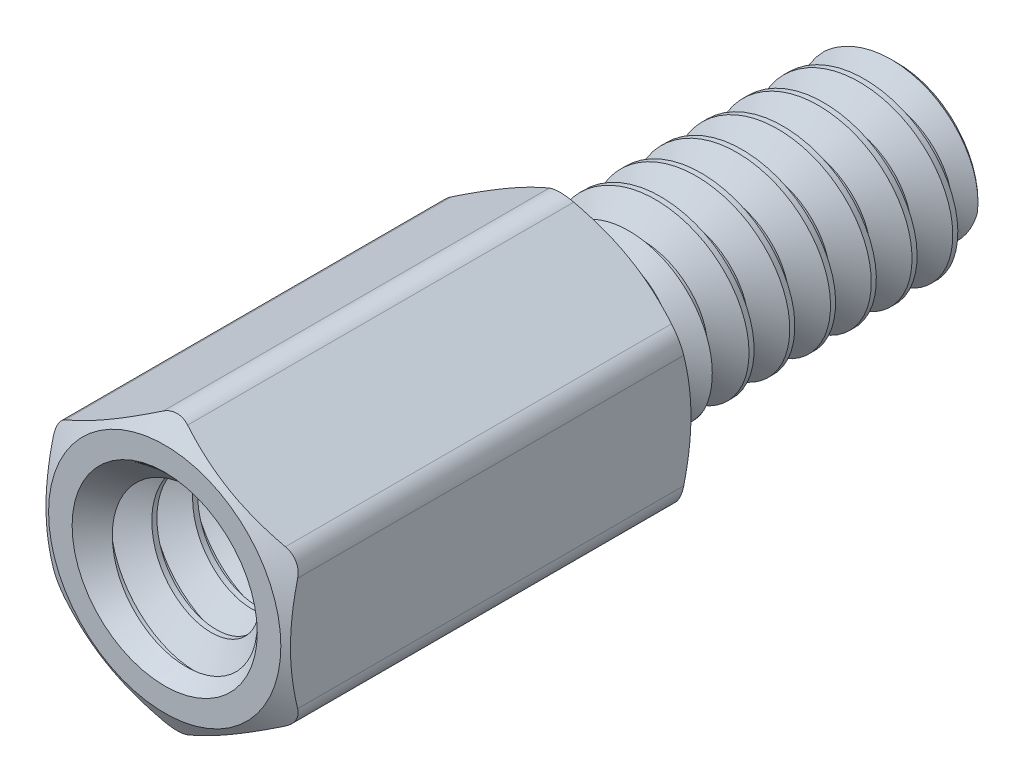
from build123d import *

# Parameters (mm, degrees)
SKETCH4_R              = 2.066925
BOSS_EXTRUDE1_DEPTH    = 7.9375
SKETCH5_OUTSIDE_W      = 64.504
SKETCH5_OUTSIDE_H      = 65.242
SKETCH5_OUTSIDE_R      = 2.2621875
CUT_EXTRUDE1_DEPTH     = 15.743251899
CUT_EXTRUDE1_DRAFT     = -60
SKETCH6_OUTSIDE_W      = 43.678
SKETCH6_OUTSIDE_H      = 44.416
SKETCH6_OUTSIDE_R      = 2.2621875
CUT_EXTRUDE2_DEPTH     = 9.73125
CUT_EXTRUDE2_DRAFT     = -60
FILLET1_R              = 0.47625
CUT_SWEEP1_PITCH       = 0.79375
CUT_SWEEP1_HEIGHT      = 6.1595
CUT_SWEEP1_RADIUS      = 1.7526
CUT_SWEEP1_START_ANGLE = 90
SKETCH9_R              = 1.9510375
BOSS_EXTRUDE2_DEPTH    = 5.5626
SKETCH10_W             = 5.5626
SKETCH10_H             = 1.7526
CUT_SWEEP2_PITCH       = 0.79375


with BuildPart() as part:
    # Sketch3 → Revolve1 (revolve)
    with BuildSketch(Plane(origin=(0, 0, 0), x_dir=(0, 0, -1), z_dir=(1, 0, 0))):
        with BuildLine():
            Line((-2.3749, 1.5541625), (-2.3749, 0))
            Line((-2.3749, 0), (6.35, 0))
            Line((6.35, 0), (6.35, 1.5541625))
            Line((6.35, 1.5541625), (6.1515625, 1.7526))
            Line((6.1515625, 1.7526), (1.05965625, 1.7526))
            Line((1.05965625, 1.7526), (0.762, 1.237044252))
            Line((0.762, 1.237044252), (0.1984375, 1.237044252))
            ThreePointArc((0.1984375, 1.237044252), (0.058120998, 1.29516525), (0, 1.435481752))
            Line((0, 1.435481752), (0, 2.38125))
            Line((0, 2.38125), (-7.9375, 2.38125))
            Line((-7.9375, 2.38125), (-7.9375, 1.9510375))
            Line((-7.9375, 1.9510375), (-7.7390625, 1.7526))
            Line((-7.7390625, 1.7526), (-2.5733375, 1.7526))
            Line((-2.5733375, 1.7526), (-2.3749, 1.5541625))
        make_face()
    revolve(axis=Axis((0, 0, -6.35), (0, 0, 1)))

    # Sketch4 → Boss-Extrude1 (add)
    with BuildSketch(Plane.XY.offset(7.9375)):
        Polygon((-2.38125, 1.374815329), (-2.38125, -1.374815329), (0, -2.749630657), (2.38125, -1.374815329), (2.38125, 1.374815329), (0, 2.749630657), align=None)
        Circle(SKETCH4_R, mode=Mode.SUBTRACT)
    extrude(amount=-BOSS_EXTRUDE1_DEPTH)


with BuildPart() as cut_extrude1_tool:
    # Sketch5 outside → Cut-Extrude1 (with draft: the straight prism first)
    with BuildSketch(Plane.XY.offset(7.9375)):
        Rectangle(SKETCH5_OUTSIDE_W, SKETCH5_OUTSIDE_H)
        Circle(SKETCH5_OUTSIDE_R, mode=Mode.SUBTRACT)
    extrude(amount=-CUT_EXTRUDE1_DEPTH)
    # Cut-Extrude1: the draft: its side faces are tilted about the plane it starts from
    cut_extrude1_sides = [cut_extrude1_tool.faces().sort_by_distance(p)[0] for p in [
        (0, -32.621, 0.06587405),
        (32.252, 0, 0.06587405),
        (0, 32.621, 0.06587405),
        (-32.252, 0, 0.06587405),
        (-2.2621875, 0, 0.06587405),
    ]]
    draft(cut_extrude1_sides, Plane.XY.offset(7.9375), CUT_EXTRUDE1_DRAFT)


with BuildPart() as part_1:
    add(part.part)

    # Cut-Extrude1: cut by cut_extrude1_tool
    add(cut_extrude1_tool.part, mode=Mode.SUBTRACT)


with BuildPart() as cut_extrude2_tool:
    # Sketch6 outside → Cut-Extrude2 (with draft: the straight prism first)
    with BuildSketch(Plane(origin=(0, 0, 0), x_dir=(-1, 0, 0), z_dir=(0, 0, -1))):
        Rectangle(SKETCH6_OUTSIDE_W, SKETCH6_OUTSIDE_H)
        Circle(SKETCH6_OUTSIDE_R, mode=Mode.SUBTRACT)
    extrude(amount=-CUT_EXTRUDE2_DEPTH)
    # Cut-Extrude2: the draft: its side faces are tilted about the plane it starts from
    cut_extrude2_sides = [cut_extrude2_tool.faces().sort_by_distance(p)[0] for p in [
        (0, -22.208, 4.865625),
        (-21.839, 0, 4.865625),
        (0, 22.208, 4.865625),
        (21.839, 0, 4.865625),
        (2.2621875, 0, 4.865625),
    ]]
    draft(cut_extrude2_sides, Plane(origin=(0, 0, 0), x_dir=(-1, 0, 0), z_dir=(0, 0, -1)), CUT_EXTRUDE2_DRAFT)


with BuildPart() as part_2:
    add(part_1.part)

    # Cut-Extrude2: cut by cut_extrude2_tool
    add(cut_extrude2_tool.part, mode=Mode.SUBTRACT)

    # Fillet1
    fillet1_edges = [part_2.edges().sort_by_distance(p)[0] for p in [
        (0, 2.749630657, 3.96875),
        (-2.38125, -1.374815329, 3.96875),
        (0, -2.749630657, 3.96875),
        (2.38125, -1.374815329, 3.96875),
        (2.38125, 1.374815329, 3.96875),
        (-2.38125, 1.374815329, 3.96875),
    ]]
    fillet(fillet1_edges, radius=FILLET1_R)

    # Cut-Sweep1: sweep along a helix
    with BuildLine() as cut_sweep1_path:
        add(Helix(CUT_SWEEP1_PITCH, CUT_SWEEP1_HEIGHT, CUT_SWEEP1_RADIUS, center=(0, 0, -6.35), direction=(0, 0, 1), mode=Mode.PRIVATE).rotate(Axis((0, 0, -6.35), (0, 0, 1)), CUT_SWEEP1_START_ANGLE))
    # Sketch7 → Cut-Sweep1 (sweep, cut)
    with BuildSketch(Plane.ZY):
        Polygon((-6.64765625, 1.237044252), (-6.746875, 1.237044252), (-7.069335938, 1.795562979), (-6.325195312, 1.795562979), align=None)
    sweep(path=cut_sweep1_path.line, is_frenet=True, mode=Mode.SUBTRACT)

    # Sketch9 → Boss-Extrude2 (add)
    with BuildSketch(Plane.XY.offset(2.3749)):
        Circle(SKETCH9_R)
    extrude(amount=BOSS_EXTRUDE2_DEPTH)


with BuildPart() as body_2:
    # Sketch10 → Revolve2 (revolve)
    with BuildSketch(Plane(origin=(0, 0, 0), x_dir=(0, 0, -1), z_dir=(1, 0, 0))):
        with Locations((-5.1562, 0.8763)):
            Rectangle(SKETCH10_W, SKETCH10_H)
    revolve(axis=Axis((0, 0, -6.35), (0, 0, 1)))

    # Cut-Sweep2: the profile of Sketch12 profile screwed along a right-hand helix of 8.008 turns, 8 arcs to a turn; built about Z, then put on its axis
    cut_sweep2_z = Axis((0, 0, 0), (0, 0, 1))
    cut_sweep2_corners = [(1.236744252, 0, -0.396701795), (1.236744252, 0, -0.297829455), (1.795562979, 0, 0.024804687), (1.795562979, 0, -0.719335938)]
    with BuildLine(mode=Mode.PRIVATE) as cut_sweep2_profile:
        Line(cut_sweep2_corners[0], cut_sweep2_corners[1])
        Line(cut_sweep2_corners[1], cut_sweep2_corners[2])
        Line(cut_sweep2_corners[2], cut_sweep2_corners[3])
        Line(cut_sweep2_corners[3], cut_sweep2_corners[0])
    cut_sweep2_cap = Face(cut_sweep2_profile.wire())
    cut_sweep2_turn_angles = [0, 22.5, 45, 67.5, 90, 112.5, 135, 157.5, 180, 202.5, 225, 247.5, 270, 292.5, 315, 337.5, 360]
    cut_sweep2_turn_weights = [1, 0.9238795325112867, 1, 0.9238795325112867, 1, 0.9238795325112867, 1, 0.9238795325112867, 1, 0.9238795325112867, 1, 0.9238795325112867, 1, 0.9238795325112867, 1, 0.9238795325112867, 1]
    cut_sweep2_turn_rails = [Edge.make_bspline([Vector(p[0], p[1], 0).rotate(cut_sweep2_z, cut_sweep2_turn_angles[k]) / cut_sweep2_turn_weights[k] + Vector(0, 0, p[2] + CUT_SWEEP2_PITCH * cut_sweep2_turn_angles[k] / 360) for k in range(17)], [0, 0, 0, 1, 1, 2, 2, 3, 3, 4, 4, 5, 5, 6, 6, 7, 7, 8, 8, 8], 2, cut_sweep2_turn_weights) for p in cut_sweep2_corners]
    cut_sweep2_turn_sides = [Face.make_surface_from_curves(cut_sweep2_turn_rails[p[0]], cut_sweep2_turn_rails[p[1]]) for p in [(0, 1), (1, 2), (2, 3), (3, 0)]]
    cut_sweep2_last_angles = [2880, 2881.44, 2882.88]
    cut_sweep2_last_weights = [1, 0.9996841892832982, 1]
    cut_sweep2_last_rails = [Edge.make_bspline([Vector(p[0], p[1], 0).rotate(cut_sweep2_z, cut_sweep2_last_angles[k]) / cut_sweep2_last_weights[k] + Vector(0, 0, p[2] + CUT_SWEEP2_PITCH * cut_sweep2_last_angles[k] / 360) for k in range(3)], [0, 0, 0, 1, 1, 1], 2, cut_sweep2_last_weights) for p in cut_sweep2_corners]
    cut_sweep2_last_sides = [Face.make_surface_from_curves(cut_sweep2_last_rails[p[0]], cut_sweep2_last_rails[p[1]]) for p in [(0, 1), (1, 2), (2, 3), (3, 0)]]
    cut_sweep2 = Plane(origin=(0, 0, 7.9375), x_dir=(0, 1, 0), z_dir=(0, 0, -1)) * Solid(Shell([*[p.moved(Location((0, 0, CUT_SWEEP2_PITCH * i))) for i in range(8) for p in cut_sweep2_turn_sides], *cut_sweep2_last_sides, cut_sweep2_cap, cut_sweep2_cap.rotate(cut_sweep2_z, 2882.88).moved(Location((0, 0, CUT_SWEEP2_PITCH * 2882.88 / 360)))]))
    add(cut_sweep2, mode=Mode.SUBTRACT)


with BuildPart() as part_3:
    add(part_2.part)

    # Combine1: cut body 2
    add(body_2.part, mode=Mode.SUBTRACT)

    # Cut-Extrude3 cone 1 section (through the dimple's axis) → Cut-Extrude3 (revolve, cut)
    with BuildSketch(Plane(origin=(0, 0, 7.9375), x_dir=(0, -1, 0), z_dir=(1, 0, 0))):
        Polygon((0, 0), (1.8034, 0), (0, 1.8034), align=None)
    revolve(axis=Axis((0, 0, 7.9375), (0, 0, -1)), mode=Mode.SUBTRACT)


solid = part_3.part
